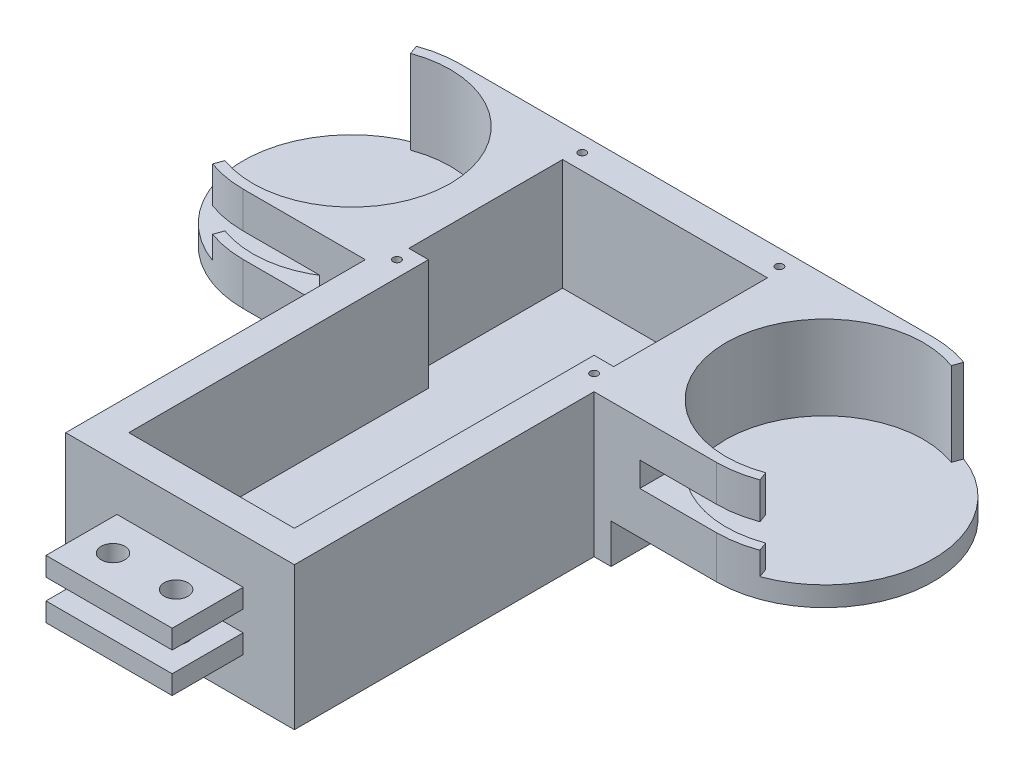
from build123d import *

# Parameters (mm, degrees)
BOSS_EXTRUDE1_DEPTH  = 26.9875
BOSS_EXTRUDE5_START  = -6.35
BOSS_EXTRUDE5_DEPTH  = 6.35
SKETCH3_W            = 36.83
SKETCH3_H            = 33.3375
BOSS_EXTRUDE7_DEPTH  = 96.52
SKETCH6_W            = 20.32
SKETCH6_H            = 33.3375
BOSS_EXTRUDE8_DEPTH  = 22.86
SKETCH7_W            = 22.86
SKETCH7_H            = 14.5415
SKETCH7_H_2          = 6.604
CUT_EXTRUDE1_DEPTH   = 21.082
SKETCH11_W           = 39.850701562
SKETCH11_H           = 7.9375
CUT_EXTRUDE3_DEPTH   = 13.716
SHELL1_START         = 3.81
SHELL1_DEPTH         = 23.1775
SHELL1_START_2       = 25.4635
SHELL1_2_DEPTH       = 1.524
SKETCH16_W           = 73.66
SKETCH16_H           = 166.37
BOSS_EXTRUDE9_DEPTH  = 12.7
CUT_EXTRUDE6_START   = -12.7
CUT_EXTRUDE6_DEPTH   = 12.7
SKETCH13_R           = 1.2446
CUT_EXTRUDE4_DEPTH   = 50.8
SKETCH20_W           = 61.160461962
SKETCH20_H           = 49.53
CUT_EXTRUDE8_DEPTH   = 35.8775
BOSS_EXTRUDE16_START = -69.85
SKETCH21_W           = 9.316323924
SKETCH21_H           = 46.0375
SKETCH21_W_2         = 9.316323925
BOSS_EXTRUDE16_DEPTH = 69.85
SKETCH22_W           = 22.86
SKETCH22_H           = 14.5415
SKETCH22_H_2         = 6.604
CUT_EXTRUDE9_DEPTH   = 19.558
SKETCH23_R           = 3.81
CUT_EXTRUDE10_DEPTH  = 36.068


# Read off the part's stored shape, not the designer's step: Shell1
with BuildPart() as part:
    # Sketch1 → Boss-Extrude1 (new body)
    with BuildSketch(Plane(origin=(0, 0, 0), x_dir=(1, 0, 0), z_dir=(0, 1, 0))):
        with BuildLine():
            ThreePointArc((-27.606252307, 13.699523808), (-37.835547974, 38.395228141), (-62.531252307, 48.624523808))
            Line((-62.531252307, 48.624523808), (-62.531252307, 45.513023808))
            ThreePointArc((-62.531252307, 45.513023808), (-40.035710723, 36.195065391), (-30.717752307, 13.699523808))
            ThreePointArc((-30.717752307, 13.699523808), (-40.035710723, -8.796017775), (-62.531252307, -18.113976192))
            Line((-62.531252307, -18.113976192), (-62.531252307, -21.225476192))
            ThreePointArc((-62.531252307, -21.225476192), (-37.835547974, -10.996180525), (-27.606252307, 13.699523808))
        make_face()
        with BuildLine():
            Line((-62.531252307, 45.513023808), (-62.531252307, 48.624523808))
            ThreePointArc((-62.531252307, 48.624523808), (-68.595914912, 48.093934582), (-74.476305812, 46.518288589))
            Line((-74.476305812, 46.518288589), (-73.412110136, 43.594434999))
            ThreePointArc((-73.412110136, 43.594434999), (-68.055608607, 45.029705258), (-62.531252307, 45.513023808))
        make_face()
        with BuildLine():
            ThreePointArc((-74.476305812, -19.119240973), (-68.595914912, -20.694886966), (-62.531252307, -21.225476192))
            Line((-62.531252307, -21.225476192), (-62.531252307, -18.113976192))
            ThreePointArc((-62.531252307, -18.113976192), (-68.055608607, -17.630657643), (-73.412110136, -16.195387383))
            Line((-73.412110136, -16.195387383), (-74.476305812, -19.119240973))
        make_face()
        with BuildLine():
            Line((13.668747693, 48.624523808), (-62.531252307, 48.624523808))
            ThreePointArc((-62.531252307, 48.624523808), (-37.835547974, 38.395228141), (-27.606252307, 13.699523808))
            ThreePointArc((-27.606252307, 13.699523808), (-37.835547974, -10.996180525), (-62.531252307, -21.225476192))
            Line((-62.531252307, -21.225476192), (13.668747693, -21.225476192))
            Line((13.668747693, -21.225476192), (13.668747693, 48.624523808))
        make_face()
    boss_extrude1 = extrude(amount=BOSS_EXTRUDE1_DEPTH)

    # Sketch1<5> → Boss-Extrude5 (add)
    with BuildSketch(Plane(origin=(0, 0, 0), x_dir=(1, 0, 0), z_dir=(0, 1, 0)).offset(BOSS_EXTRUDE5_START)):
        with BuildLine():
            Line((-62.531252307, -21.225476192), (13.668747693, -21.225476192))
            Line((13.668747693, -21.225476192), (13.668747693, 48.624523808))
            Line((13.668747693, 48.624523808), (-62.531252307, 48.624523808))
            ThreePointArc((-62.531252307, 48.624523808), (-97.456252307, 13.699523808), (-62.531252307, -21.225476192))
        make_face()
    boss_extrude5 = extrude(amount=BOSS_EXTRUDE5_DEPTH)

    # Mirror1: Boss-Extrude1, Boss-Extrude5 across plane
    add(boss_extrude1.mirror(Plane(origin=(13.668747693, 26.9875, 0), x_dir=(0, 0, 1), z_dir=(1, 0, 0))))
    add(boss_extrude5.mirror(Plane(origin=(13.668747693, 26.9875, 0), x_dir=(0, 0, 1), z_dir=(1, 0, 0))))

    # Sketch3 → Boss-Extrude7 (add)
    with BuildSketch(Plane.XY.offset(21.225476192)):
        with Locations((-4.746252307, 10.31875)):
            Rectangle(SKETCH3_W, SKETCH3_H)
        with Locations((32.083747693, 10.31875)):
            Rectangle(SKETCH3_W, SKETCH3_H)
    extrude(amount=BOSS_EXTRUDE7_DEPTH)

    # Sketch6 → Boss-Extrude8 (add)
    with BuildSketch(Plane.XY.offset(117.745476192)):
        with Locations((3.508747693, 10.31875)):
            Rectangle(SKETCH6_W, SKETCH6_H)
        with Locations((23.828747693, 10.31875)):
            Rectangle(SKETCH6_W, SKETCH6_H)
    extrude(amount=BOSS_EXTRUDE8_DEPTH)

    # Sketch7 → Cut-Extrude1 (cut)
    with BuildSketch(Plane.ZY.offset(6.651252307)):
        with Locations((129.175476192, 19.71675)):
            Rectangle(SKETCH7_W, SKETCH7_H)
        with Locations((129.175476192, 3.048)):
            Rectangle(SKETCH7_W, SKETCH7_H_2)
    extrude(amount=-CUT_EXTRUDE1_DEPTH, mode=Mode.SUBTRACT)

    # Sketch11 → Cut-Extrude3 (cut)
    with BuildSketch(Plane.XY.offset(21.225476192)):
        with Locations((-57.818603088, 11.33475)):
            Rectangle(SKETCH11_W, SKETCH11_H)
    cut_extrude3 = extrude(amount=-CUT_EXTRUDE3_DEPTH, mode=Mode.SUBTRACT)

    # Mirror2: Cut-Extrude3 across plane
    add(cut_extrude3.mirror(Plane.ZY.offset(-13.668747693)), mode=Mode.SUBTRACT)

    # Shell1 outline → Shell1 (cut)
    with BuildSketch(Plane(origin=(0, 0, 0), x_dir=(1, 0, 0), z_dir=(0, 1, 0)).offset(SHELL1_START)):
        with BuildLine():
            Line((-27.733252307, -9.771179169), (-27.733252307, -11.065476192))
            Line((-27.733252307, -11.065476192), (-13.001252307, -11.065476192))
            Line((-13.001252307, -11.065476192), (-13.001252307, -107.585476192))
            Line((-13.001252307, -107.585476192), (40.338747693, -107.585476192))
            Line((40.338747693, -107.585476192), (40.338747693, -11.065476192))
            Line((40.338747693, -11.065476192), (55.070747693, -11.065476192))
            Line((55.070747693, -11.065476192), (55.070747693, -9.771179169))
            ThreePointArc((55.070747693, -9.771179169), (47.902697541, 14.49030625), (55.979671618, 38.464523808))
            Line((55.979671618, 38.464523808), (-28.642176231, 38.464523808))
            ThreePointArc((-28.642176231, 38.464523808), (-20.565202155, 14.49030625), (-27.733252307, -9.771179169))
        make_face()
    extrude(amount=SHELL1_DEPTH, mode=Mode.SUBTRACT)

    # Shell1 2 outline → Shell1 2 (cut)
    with BuildSketch(Plane(origin=(0, 0, 0), x_dir=(1, 0, 0), z_dir=(0, 1, 0)).offset(SHELL1_START_2)):
        with BuildLine():
            ThreePointArc((-27.733252307, -9.771179169), (-28.181617576, -10.422609102), (-28.642176231, -11.065476192))
            Line((-28.642176231, -11.065476192), (-27.733252307, -11.065476192))
            Line((-27.733252307, -11.065476192), (-27.733252307, -9.771179169))
        make_face()
        with BuildLine():
            ThreePointArc((55.979671618, -11.065476192), (55.519112962, -10.422609101), (55.070747693, -9.771179169))
            Line((55.070747693, -9.771179169), (55.070747693, -11.065476192))
            Line((55.070747693, -11.065476192), (55.979671618, -11.065476192))
        make_face()
    extrude(amount=SHELL1_2_DEPTH, mode=Mode.SUBTRACT)

    # Sketch16 → Boss-Extrude9 (add)
    with BuildSketch(Plane.XZ.offset(6.35)):
        with Locations((13.668747693, 34.560476192)):
            Rectangle(SKETCH16_W, SKETCH16_H)
    extrude(amount=BOSS_EXTRUDE9_DEPTH)

    # Sketch17 → Cut-Extrude6 (cut)
    with BuildSketch(Plane(origin=(0, 3.81, 0), x_dir=(1, 0, 0), z_dir=(0, 1, 0)).offset(CUT_EXTRUDE6_START)):
        with BuildLine():
            Line((-28.642176231, 38.464523808), (55.979671618, 38.464523808))
            ThreePointArc((55.979671618, 38.464523808), (47.895247693, 13.699523808), (55.979671618, -11.065476192))
            Line((55.979671618, -11.065476192), (40.338747693, -11.065476192))
            Line((40.338747693, -11.065476192), (40.338747693, -107.585476192))
            Line((40.338747693, -107.585476192), (-13.001252307, -107.585476192))
            Line((-13.001252307, -107.585476192), (-13.001252307, -11.065476192))
            Line((-13.001252307, -11.065476192), (-28.642176231, -11.065476192))
            ThreePointArc((-28.642176231, -11.065476192), (-20.557752307, 13.699523808), (-28.642176231, 38.464523808))
        make_face()
    extrude(amount=CUT_EXTRUDE6_DEPTH, mode=Mode.SUBTRACT)

    # Sketch13 → Cut-Extrude4 (cut)
    with BuildSketch(Plane(origin=(0, 26.9875, 0), x_dir=(1, 0, 0), z_dir=(0, 1, 0))):
        with Locations(Location((45.418747693, -16.145476192, 0), (0, 0, 270))):
            Circle(SKETCH13_R)
        with Locations(Location((-18.081252307, -16.145476192, 0), (0, 0, 270))):
            Circle(SKETCH13_R)
        with Locations(Location((-18.081252307, 43.544523808, 0), (0, 0, 270))):
            Circle(SKETCH13_R)
        with Locations(Location((45.418747693, 43.544523808, 0), (0, 0, 270))):
            Circle(SKETCH13_R)
    extrude(amount=-CUT_EXTRUDE4_DEPTH, mode=Mode.SUBTRACT)

    # Sketch20 → Cut-Extrude8 (cut)
    with BuildSketch(Plane(origin=(0, 26.9875, 0), x_dir=(1, 0, 0), z_dir=(0, 1, 0))):
        with Locations((17.578978674, 13.699523808)):
            Rectangle(SKETCH20_W, SKETCH20_H)
    extrude(amount=-CUT_EXTRUDE8_DEPTH, mode=Mode.SUBTRACT)

    # Sketch21 → Boss-Extrude16 (add)
    with BuildSketch(Plane(origin=(0, 0, -48.624523808), x_dir=(-1, 0, 0), z_dir=(0, 0, -1)).offset(BOSS_EXTRUDE16_START)):
        with Locations((23.984014269, 3.96875)):
            Rectangle(SKETCH21_W, SKETCH21_H)
        with Locations((-51.321509656, 3.96875)):
            Rectangle(SKETCH21_W_2, SKETCH21_H)
    extrude(amount=BOSS_EXTRUDE16_DEPTH)

    # Sketch22 → Cut-Extrude9 (cut)
    with BuildSketch(Plane.ZY.offset(-14.430747693)):
        with Locations((129.175476192, 19.71675)):
            Rectangle(SKETCH22_W, SKETCH22_H)
        with Locations((129.175476192, 3.048)):
            Rectangle(SKETCH22_W, SKETCH22_H_2)
    extrude(amount=-CUT_EXTRUDE9_DEPTH, mode=Mode.SUBTRACT)

    # Sketch23 → Cut-Extrude10 (cut)
    with BuildSketch(Plane(origin=(0, 12.446, 0), x_dir=(1, 0, 0), z_dir=(0, 1, 0))):
        with Locations(Location((3.508747693, -129.175476192, 0), (0, 0, 180))):
            Circle(SKETCH23_R)
        with Locations(Location((23.828747693, -129.175476192, 0), (0, 0, 180))):
            Circle(SKETCH23_R)
    extrude(amount=-CUT_EXTRUDE10_DEPTH, mode=Mode.SUBTRACT)


solid = part.part
